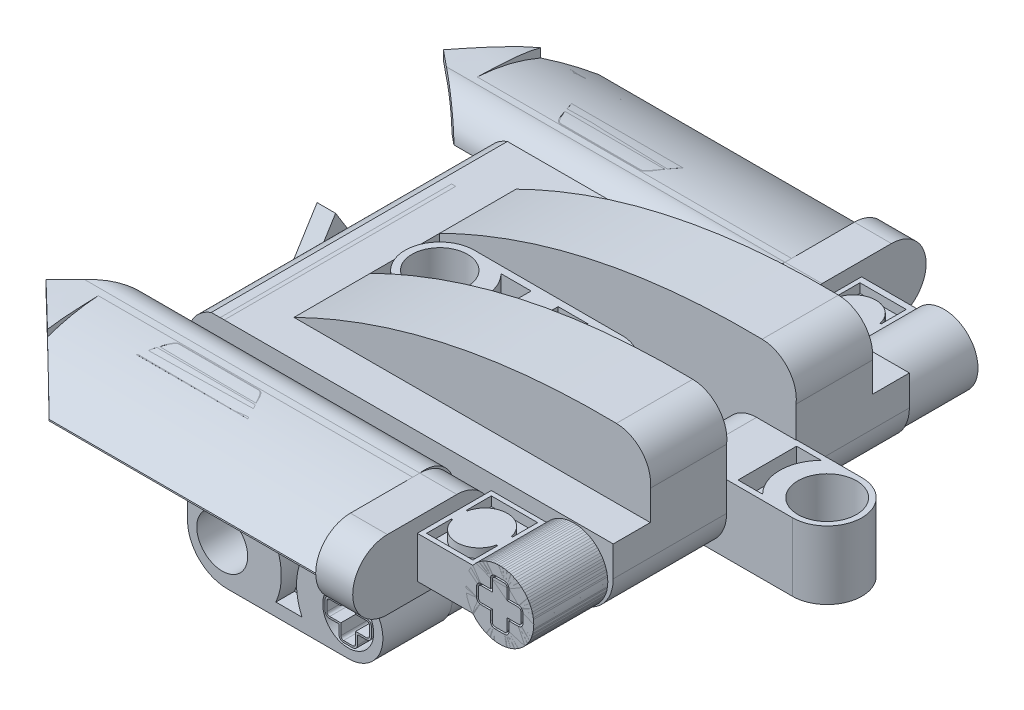
from build123d import *
from OCP.BRepAlgoAPI import BRepAlgoAPI_Cut
from OCP.TopTools import TopTools_ListOfShape

# Parameters (mm, degrees)
BOSS_EXTRUDE2_DEPTH      = 32
SKETCH2_W                = 44.115185982
SKETCH2_H                = 4
SKETCH2_W_2              = 43.1238244
CUT_EXTRUDE1_DEPTH       = 12
SKETCH3_W                = 38.535650362
SKETCH3_H                = 7.5
CUT_EXTRUDE2_DEPTH       = 11
SKETCH4_W                = 17
SKETCH4_H                = 21.78758901
CUT_EXTRUDE3_DEPTH       = 7.5
BOSS_EXTRUDE5_DEPTH      = 25
SKETCH9_W                = 17
SKETCH9_H                = 7.5
CUT_EXTRUDE5_DEPTH       = 55.618775146
BOSS_EXTRUDE6_DEPTH      = 4
BOSS_EXTRUDE7_DEPTH      = 4
SKETCH12_R               = 3.66973068
BOSS_EXTRUDE8_DEPTH      = 14
SKETCH13_R               = 4.472188962
BOSS_EXTRUDE9_DEPTH      = 7.5
SKETCH14_R               = 2.5
BOSS_EXTRUDE10_DEPTH     = 10
BOSS_EXTRUDE11_DEPTH     = 2
SKETCH16_R               = 3.000305408
BOSS_EXTRUDE12_DEPTH     = 3.5
CUT_EXTRUDE6_DEPTH       = 2
BOSS_EXTRUDE13_DEPTH     = 8
BOSS_EXTRUDE14_DEPTH     = 4
BOSS_EXTRUDE16_DEPTH     = 38.4
BOSS_EXTRUDE17_DEPTH     = 7.5
CUT_EXTRUDE13_DEPTH      = 34
CUT_EXTRUDE14_START      = 12.794424309
CUT_EXTRUDE14_DEPTH      = 16.041695252
SKETCH31_R               = 3.677039636
BOSS_EXTRUDE18_DEPTH     = 34
BOSS_EXTRUDE19_START     = -20.3
BOSS_EXTRUDE19_DEPTH     = 7.5
FILLET1_START            = -4.26381126
FILLET1_DEPTH            = 8.26381126
SKETCH34_R               = 3.166482097
CUT_EXTRUDE15_DEPTH      = 67.385597078
CUT_EXTRUDE16_DEPTH      = 2
CUT_EXTRUDE18_DEPTH      = 1
CUT_EXTRUDE19_DEPTH      = 1
CUT_EXTRUDE20_DEPTH      = 80.14808
SKETCH41_R               = 2.75
CUT_EXTRUDE23_DEPTH      = 74.811781159
BOSS_EXTRUDE20_DEPTH     = 32
SKETCH43_R               = 2.75
CUT_EXTRUDE24_DEPTH      = 12
SKETCH45_R               = 2.75
CUT_EXTRUDE25_DEPTH      = 12
CUT_EXTRUDE26_DEPTH      = 2
CUT_EXTRUDE27_DEPTH      = 2
CUT_EXTRUDE28_DEPTH      = 2
CUT_EXTRUDE29_DEPTH      = 2
CUT_EXTRUDE31_DEPTH      = 12
CUT_EXTRUDE41_DEPTH      = 12
CUT_EXTRUDE42_DEPTH      = 12
CUT_EXTRUDE43_DEPTH      = 12
CUT_EXTRUDE43_DEPTH_BACK = 12


with BuildPart() as part:
    # Sketch1 → Boss-Extrude2 (new body)
    with BuildSketch(Plane.XY):
        with BuildLine():
            Line((-1.702951694, 3.212286003), (3.23618874, 3.218855942))
            add(Edge.make_bspline(
                [(38.075385005, 10.724063237), (19.092860526, 11.058020979), (3.23618874, 3.218855942)],
                knots=[0, 0, 0, 0.804971989, 0.804971989, 0.804971989], degree=2))
            ThreePointArc((38.075385005, 10.724063237), (40.853292016, 9.414045085), (41.73618874, 6.472377481))
            Line((41.73618874, 6.472377481), (41.73618874, 0.00239581))
            ThreePointArc((41.73618874, 0.00239581), (40.487492588, -3.013421211), (37.472377481, -4.26381126))
            Line((37.472377481, -4.26381126), (3.23618874, -4.283042964))
            Line((3.23618874, -4.283042964), (3.23618874, -14.2851932))
            Line((3.23618874, -14.2851932), (13.097524642, -14.2851932))
            ThreePointArc((13.097524642, -14.2851932), (16.847524642, -18.0351932), (13.097524642, -21.7851932))
            Line((13.097524642, -21.7851932), (0, -21.7851932))
            ThreePointArc((0, -21.7851932), (-3.014969855, -20.536351796), (-4.26381126, -17.52138194))
            Line((-4.26381126, -17.52138194), (-4.26381126, 0.00239581))
            ThreePointArc((-4.26381126, 0.00239581), (-3.438448359, 1.970394564), (-1.702951694, 3.212286003))
        make_face()
    extrude(amount=-BOSS_EXTRUDE2_DEPTH)

    # Sketch2 → Cut-Extrude1 (cut)
    with BuildSketch(Plane(origin=(-0.00427592, 3.214545545, 0), x_dir=(0.9999991153136247, 0.0013301774197189266, 0), z_dir=(-0.0013301774197189266, 0.9999991153136247, 0))):
        with Locations((25.298060518, 2)):
            Rectangle(SKETCH2_W, SKETCH2_H)
        with Locations((24.802379727, 30)):
            Rectangle(SKETCH2_W_2, SKETCH2_H)
    extrude(amount=CUT_EXTRUDE1_DEPTH, mode=Mode.SUBTRACT)

    # Sketch3 → Cut-Extrude2 (cut, symmetric)
    with BuildSketch(Plane(origin=(-0.00427592, 3.214545545, 0), x_dir=(0.9999991153136247, 0.0013301774197189266, 0), z_dir=(-0.0013301774197189266, 0.9999991153136247, 0))):
        with Locations((22.508292708, 16)):
            Rectangle(SKETCH3_W, SKETCH3_H)
    extrude(amount=CUT_EXTRUDE2_DEPTH, both=True, mode=Mode.SUBTRACT)

    # Sketch4 → Cut-Extrude3 (cut)
    with BuildSketch(Plane.ZY.offset(4.26381126)):
        with Locations((-16, -10.891398695)):
            Rectangle(SKETCH4_W, SKETCH4_H)
    extrude(amount=-CUT_EXTRUDE3_DEPTH, mode=Mode.SUBTRACT)

    # Sketch7 → Boss-Extrude5 (add)
    with BuildSketch(Plane.XY):
        with BuildLine():
            ThreePointArc((3.241178169, -0.532090709), (-0.511316545, -4.283037359), (-4.26381126, -0.532090709))
            ThreePointArc((-4.26381126, -0.532090709), (-0.511316545, 3.220404006), (3.241178169, -0.532090709))
        make_face()
    extrude(amount=-BOSS_EXTRUDE5_DEPTH)

    # Sketch9 → Cut-Extrude5 (cut, through all)
    with BuildSketch(Plane.ZY.offset(-3.23618874)):
        with Locations((-16, -18.0351932)):
            Rectangle(SKETCH9_W, SKETCH9_H)
    extrude(amount=-CUT_EXTRUDE5_DEPTH, mode=Mode.SUBTRACT)


with BuildPart() as body_2:
    # Sketch10 → Boss-Extrude6 (new body)
    with BuildSketch(Plane.XY.offset(-24.5)):
        with BuildLine():
            Line((-0.301242903, -14.36546252), (13.097524642, -14.36546252))
            ThreePointArc((13.097524642, -14.36546252), (16.767255322, -18.0351932), (13.097524642, -21.70492388))
            Line((13.097524642, -21.70492388), (-0.301242903, -21.70492388))
            ThreePointArc((-0.301242903, -21.70492388), (-3.970973583, -18.0351932), (-0.301242903, -14.36546252))
        make_face()
    extrude(amount=BOSS_EXTRUDE6_DEPTH)


with BuildPart() as body_3:
    # Sketch11 → Boss-Extrude7 (new body)
    with BuildSketch(Plane(origin=(0, 0, -7.5), x_dir=(-1, 0, 0), z_dir=(0, 0, -1))):
        with BuildLine():
            Line((-13.098801019, -14.319293562), (0.299966526, -14.319293562))
            ThreePointArc((0.299966526, -14.319293562), (3.969697206, -17.989024242), (0.299966526, -21.658754922))
            Line((0.299966526, -21.658754922), (-13.098801019, -21.658754922))
            ThreePointArc((-13.098801019, -21.658754922), (-16.768531699, -17.989024242), (-13.098801019, -14.319293562))
        make_face()
    extrude(amount=BOSS_EXTRUDE7_DEPTH)


with BuildPart() as body_4:
    # Sketch12 → Boss-Extrude8 (new body)
    with BuildSketch(Plane(origin=(0, 0, -11.5), x_dir=(-1, 0, 0), z_dir=(0, 0, -1))):
        with Locations((0.299966526, -17.989024242)):
            Circle(SKETCH12_R)
    extrude(amount=BOSS_EXTRUDE8_DEPTH)


with BuildPart() as body_5:
    # Sketch13 → Boss-Extrude9 (new body)
    with BuildSketch(Plane(origin=(0, -21.819293562, 0), x_dir=(1, 0, 0), z_dir=(0, 1, 0))):
        with Locations(Location((-0.299966526, 15.996741348, 0), (0, 0, 180))):
            Circle(SKETCH13_R)
    extrude(amount=BOSS_EXTRUDE9_DEPTH)


with BuildPart() as body_6:
    # Sketch14 → Boss-Extrude10 (new body)
    with BuildSketch(Plane(origin=(0, -14.319293562, 0), x_dir=(1, 0, 0), z_dir=(0, 1, 0))):
        with Locations(Location((-0.299966526, 15.996741348, 0), (0, 0, 180))):
            Circle(SKETCH14_R)
    extrude(amount=BOSS_EXTRUDE10_DEPTH)


with BuildPart() as body_7:
    # Sketch15 → Boss-Extrude11 (new body)
    with BuildSketch(Plane.ZY.offset(4.26381126)):
        Polygon((-16, 3.212286003), (-25.960182344, -12.787713997), (-6.039817656, -12.787713997), align=None)
    extrude(amount=BOSS_EXTRUDE11_DEPTH)


with BuildPart() as body_8:
    # Sketch16 → Boss-Extrude12 (new, symmetric)
    with BuildSketch(Plane(origin=(0, 0, 0), x_dir=(1, 0, 0), z_dir=(0, 1, 0))):
        with BuildLine():
            Line((6.98618874, 19.75), (22.98618874, 19.75))
            ThreePointArc((22.98618874, 19.75), (26.73618874, 16), (22.98618874, 12.25))
            Line((22.98618874, 12.25), (6.98618874, 12.25))
            ThreePointArc((6.98618874, 12.25), (3.23618874, 16), (6.98618874, 19.75))
        make_face()
        with Locations(Location((6.98618874, 16, 0), (0, 0, 270))):
            Circle(SKETCH16_R, mode=Mode.SUBTRACT)
        with Locations(Location((22.98618874, 16, 0), (0, 0, 270))):
            Circle(SKETCH16_R, mode=Mode.SUBTRACT)
    extrude(amount=BOSS_EXTRUDE12_DEPTH, both=True)

    # Sketch17 → Cut-Extrude6 (cut)
    with BuildSketch(Plane(origin=(0, 3.5, 0), x_dir=(1, 0, 0), z_dir=(0, 1, 0))):
        with BuildLine():
            Line((10.605788643, 19.000305408), (13.858381621, 19.000305408))
            Line((13.858381621, 19.000305408), (13.858381621, 12.999694592))
            Line((13.858381621, 12.999694592), (10.605788643, 12.999694592))
            ThreePointArc((10.605788643, 12.999694592), (11.848555834, 16), (10.605788643, 19.000305408))
        make_face()
        with BuildLine():
            Line((20.033757679, 12.999694592), (16.781164701, 12.999694592))
            Line((16.781164701, 12.999694592), (16.781164701, 19.000305408))
            Line((16.781164701, 19.000305408), (20.033757679, 19.000305408))
            ThreePointArc((20.033757679, 19.000305408), (18.790990488, 16), (20.033757679, 12.999694592))
        make_face()
    extrude(amount=-CUT_EXTRUDE6_DEPTH, mode=Mode.SUBTRACT)


with BuildPart() as body_9:
    # Sketch18 → Boss-Extrude13 (new body)
    with BuildSketch(Plane.XY):
        with BuildLine():
            Line((34.56409268, 1.680710245), (28.56409268, 1.680710245))
            Line((28.56409268, 1.680710245), (28.56409268, -2.819289755))
            Line((28.56409268, -2.819289755), (34.56409268, -2.819289755))
            ThreePointArc((34.56409268, -2.819289755), (41.149417117, -0.569289755), (34.56409268, 1.680710245))
        make_face()
    extrude(amount=BOSS_EXTRUDE13_DEPTH)


with BuildPart() as body_10:
    # Sketch19 → Boss-Extrude14 (new body)
    with BuildSketch(Plane.ZY.offset(-28.56409268)):
        with BuildLine():
            Line((11.229953049, -4.320127931), (3.729953049, -4.320127931))
            ThreePointArc((3.729953049, -4.320127931), (-0.020046951, -0.570127931), (3.729953049, 3.179872069))
            Line((3.729953049, 3.179872069), (11.229953049, 3.179872069))
            ThreePointArc((11.229953049, 3.179872069), (14.979953049, -0.570127931), (11.229953049, -4.320127931))
        make_face()
    extrude(amount=BOSS_EXTRUDE14_DEPTH)


with BuildPart() as body_11:
    # Sketch24 → Boss-Extrude16 (new body)
    with BuildSketch(Plane.ZY.offset(-24.56409268)):
        with BuildLine():
            Line((0, 0), (1, 0))
            ThreePointArc((1, 0), (1.799126894, 1.705934773), (3.621301326, 2.183948983))
            add(Edge.make_bspline(
                [(14.055609261, -0.965878552), (14.00316326, -0.787572066), (13.863542609, -0.427121258), (13.512494301, 0.144306384), (12.906219021, 0.730186055), (11.862686925, 1.274546234), (10.075490307, 1.789901434), (7.283127213, 2.067368154), (4.822788537, 2.126020481), (3.621301326, 2.183948983)],
                knots=[-0.004258653, -0.004258653, -0.004258653, -0.004258653, 0.058507512, 0.121273678, 0.24680601, 0.372338342, 0.497870673, 0.748935337, 1, 1, 1, 1], degree=3))
            Line((14.055609261, -0.965878552), (15.014970514, -0.683697782))
            add(Edge.make_bspline(
                [(3.729953049, 3.179872069), (8.464913465, 2.951580699), (13.880932145, 3.171818212), (15.014970514, -0.683697782)],
                knots=[0, 0, 0, 0, 1, 1, 1, 1], degree=3))
            ThreePointArc((3.729953049, 3.179872069), (1.131137136, 2.450721125), (0, 0))
        make_face()
    extrude(amount=BOSS_EXTRUDE16_DEPTH)


with BuildPart() as body_12:
    # Sketch27 → Boss-Extrude17 (new body)
    with BuildSketch(Plane.XY):
        with BuildLine():
            Line((-0.563437375, 3.136846364), (8.061078764, 3.136846364))
            ThreePointArc((8.061078764, 3.136846364), (11.769668271, -0.571743143), (8.061078764, -4.280332649))
            Line((8.061078764, -4.280332649), (-0.563437375, -4.280332649))
            ThreePointArc((-0.563437375, -4.280332649), (-4.272026881, -0.571743143), (-0.563437375, 3.136846364))
        make_face()
    extrude(amount=BOSS_EXTRUDE17_DEPTH)


with BuildPart() as cut_extrude13_tool:
    # Sketch29 → Cut-Extrude13 (new body)
    with BuildSketch(Plane.ZY.offset(-24.56409268)):
        with BuildLine():
            Line((3.729953049, 3.179872069), (11.229953049, 3.179872069))
            ThreePointArc((11.229953049, 3.179872069), (13.881603478, 2.081522498), (14.979953049, -0.570127931))
            ThreePointArc((14.979953049, -0.570127931), (9.634679324, 2.144050894), (3.729953049, 3.179872069))
        make_face()
    extrude(amount=CUT_EXTRUDE13_DEPTH)


with BuildPart() as body_11_1:
    add(body_11.part)

    # Cut-Extrude13: cut by cut_extrude13_tool
    add(cut_extrude13_tool.part, mode=Mode.SUBTRACT)


with BuildPart() as body_12_1:
    add(body_12.part)

    # Cut-Extrude13: cut by cut_extrude13_tool
    add(cut_extrude13_tool.part, mode=Mode.SUBTRACT)

    # Cut-Extrude14: read off the stored shape, not the designer's step
    # Cut-Extrude14 outline → Cut-Extrude14 (cut)
    with BuildSketch(Plane.ZY.offset(-24.56409268).offset(CUT_EXTRUDE14_START)):
        with BuildLine():
            Line((0, 3.136846364), (0, 0))
            ThreePointArc((0, 0), (0.888029379, 2.053731462), (2.845888469, 3.136873594))
            Line((2.845888469, 3.136873594), (0, 3.136846364))
        make_face()
    extrude(amount=CUT_EXTRUDE14_DEPTH, mode=Mode.SUBTRACT)


with BuildPart() as body_13:
    # Sketch31 → Boss-Extrude18 (new body)
    with BuildSketch(Plane.XY.offset(8)):
        with Locations((37.472377481, -0.569289755)):
            Circle(SKETCH31_R)
    extrude(amount=-BOSS_EXTRUDE18_DEPTH)


with BuildPart() as body_14:
    # Sketch33 → Boss-Extrude19 (new body)
    with BuildSketch(Plane.XY.offset(8).offset(BOSS_EXTRUDE19_START)):
        Polygon((37.472377481, 3.107749881), (52.551789104, 3.107749881), (52.551789104, -4.246329391), (37.472377481, -4.26381126), align=None)
    extrude(amount=-BOSS_EXTRUDE19_DEPTH)


with BuildPart() as fillet1_tool:
    # Fillet1: read off the stored shape, not the designer's step
    # Fillet1 outline → Fillet1 (new body)
    with BuildSketch(Plane(origin=(0, 0, 0), x_dir=(1, 0, 0), z_dir=(0, 1, 0)).offset(FILLET1_START)):
        with BuildLine():
            ThreePointArc((48.80178149, 19.800002538), (51.453433714, 18.701652224), (52.551784028, 16.05))
            Line((52.551784028, 16.05), (52.551789104, 19.8))
            Line((52.551789104, 19.8), (48.80178149, 19.800002538))
        make_face()
        with BuildLine():
            ThreePointArc((52.551784028, 16.05), (51.453433714, 13.398347776), (48.80178149, 12.299997462))
            Line((48.80178149, 12.299997462), (52.551789104, 12.3))
            Line((52.551789104, 12.3), (52.551784028, 16.05))
        make_face()
    extrude(amount=FILLET1_DEPTH)


with BuildPart() as body_14_1:
    add(body_14.part)

    # Fillet1: cut by fillet1_tool, with a tolerance
    fillet1_stock = TopTools_ListOfShape()
    fillet1_stock.Append(body_14_1.part.wrapped)
    fillet1_tools = TopTools_ListOfShape()
    fillet1_tools.Append(fillet1_tool.part.wrapped)
    fillet1_cut = BRepAlgoAPI_Cut()
    fillet1_cut.SetArguments(fillet1_stock)
    fillet1_cut.SetTools(fillet1_tools)
    fillet1_cut.SetFuzzyValue(0.00001)
    fillet1_cut.Build()
    add(Compound.cast(fillet1_cut.Shape()).solids(), mode=Mode.REPLACE)

    # Sketch34 → Cut-Extrude15 (cut, through all)
    with BuildSketch(Plane(origin=(0, 3.107749881, 0), x_dir=(1, 0, 0), z_dir=(0, 1, 0))):
        with Locations(Location((48.80178149, 16.05, 0), (0, 0, 270))):
            Circle(SKETCH34_R)
    extrude(amount=-CUT_EXTRUDE15_DEPTH, mode=Mode.SUBTRACT)

    # Sketch35 → Cut-Extrude16 (cut)
    with BuildSketch(Plane(origin=(0, 3.107749881, 0), x_dir=(1, 0, 0), z_dir=(0, 1, 0))):
        with BuildLine():
            Line((44.995529866, 19.216482097), (42.332858945, 19.216482097))
            Line((42.332858945, 19.216482097), (42.332858945, 12.883517903))
            Line((42.332858945, 12.883517903), (44.995529866, 12.883517903))
            ThreePointArc((44.995529866, 12.883517903), (43.683930037, 16.05), (44.995529866, 19.216482097))
        make_face()
    extrude(amount=-CUT_EXTRUDE16_DEPTH, mode=Mode.SUBTRACT)


with BuildPart() as body_15:
    # Mirror1: mirrored copy
    add(body_11_1.part.mirror(Plane.XY.offset(-16)))

    # Sketch53 → Cut-Extrude42 (cut)
    with BuildSketch(Plane(origin=(0, 0, 0), x_dir=(1, 0, 0), z_dir=(0, 1, 0))):
        Polygon((-13.83590732, 37.22), (-7.481864303, 32), (-13.83590732, 32), align=None)
    extrude(amount=CUT_EXTRUDE42_DEPTH, mode=Mode.SUBTRACT)

    # Sketch54 → Cut-Extrude43 (cut, two sides: drawn at the far end of the back side and taken through both)
    with BuildSketch(Plane(origin=(0, 0, 0), x_dir=(1, 0, 0), z_dir=(0, 1, 0)).offset(-CUT_EXTRUDE43_DEPTH_BACK)):
        Polygon((-13.83590732, 37.22), (-6.119990132, 47.927418423), (-13.840886664, 47.927418423), align=None)
    extrude(amount=CUT_EXTRUDE43_DEPTH + CUT_EXTRUDE43_DEPTH_BACK, mode=Mode.SUBTRACT)


with BuildPart() as body_16:
    # Mirror1 2: mirrored copy
    add(body_9.part.mirror(Plane.XY.offset(-16)))

    # Sketch38 → Cut-Extrude19 (cut)
    with BuildSketch(Plane(origin=(0, 1.680710245, 0), x_dir=(1, 0, 0), z_dir=(0, 1, 0))):
        with BuildLine():
            Line((29.033448476, 39.360022667), (29.033448476, 36.663656148))
            Line((29.033448476, 36.663656148), (29.156601429, 36.663656148))
            ThreePointArc((29.156601429, 36.663656148), (31.533448476, 38.592524584), (33.910295522, 36.663656148))
            Line((33.910295522, 36.663656148), (34.033448476, 36.663656148))
            Line((34.033448476, 36.663656148), (34.033448476, 39.360022667))
            Line((34.033448476, 39.360022667), (29.033448476, 39.360022667))
        make_face()
        with BuildLine():
            Line((34.033448476, 32.360022667), (29.033448476, 32.360022667))
            Line((29.033448476, 32.360022667), (29.033448476, 35.056389187))
            Line((29.033448476, 35.056389187), (29.156601429, 35.056389187))
            ThreePointArc((29.156601429, 35.056389187), (31.533448476, 33.12752075), (33.910295522, 35.056389187))
            Line((33.910295522, 35.056389187), (34.033448476, 35.056389187))
            Line((34.033448476, 35.056389187), (34.033448476, 32.360022667))
        make_face()
    extrude(amount=-CUT_EXTRUDE19_DEPTH, mode=Mode.SUBTRACT)


with BuildPart() as body_17:
    # Mirror1 3: mirrored copy
    add(body_10.part.mirror(Plane.XY.offset(-16)))


with BuildPart() as body_18:
    # Mirror1 4: mirrored copy
    add(body_12_1.part.mirror(Plane.XY.offset(-16)))


with BuildPart() as cut_extrude18_tool:
    # Sketch37 → Cut-Extrude18 (new body)
    with BuildSketch(Plane(origin=(0, 1.680710245, 0), x_dir=(1, 0, 0), z_dir=(0, 1, 0))):
        with BuildLine():
            Line((29.06409268, -0.5), (29.06409268, -3.196366519))
            Line((29.06409268, -3.196366519), (29.187245634, -3.196366519))
            ThreePointArc((29.187245634, -3.196366519), (31.56409268, -1.267498083), (33.940939726, -3.196366519))
            Line((33.940939726, -3.196366519), (34.06409268, -3.196366519))
            Line((34.06409268, -3.196366519), (34.06409268, -0.5))
            Line((34.06409268, -0.5), (29.06409268, -0.5))
        make_face()
        with BuildLine():
            Line((34.06409268, -7.5), (29.06409268, -7.5))
            Line((29.06409268, -7.5), (29.06409268, -4.803633481))
            Line((29.06409268, -4.803633481), (29.187245634, -4.803633481))
            ThreePointArc((29.187245634, -4.803633481), (31.56409268, -6.732501917), (33.940939726, -4.803633481))
            Line((33.940939726, -4.803633481), (34.06409268, -4.803633481))
            Line((34.06409268, -4.803633481), (34.06409268, -7.5))
        make_face()
    extrude(amount=-CUT_EXTRUDE18_DEPTH)


with BuildPart() as body_9_1:
    add(body_9.part)

    # Cut-Extrude18: cut by cut_extrude18_tool
    add(cut_extrude18_tool.part, mode=Mode.SUBTRACT)


with BuildPart() as body_13_1:
    add(body_13.part)

    # Cut-Extrude18: cut by cut_extrude18_tool
    add(cut_extrude18_tool.part, mode=Mode.SUBTRACT)


with BuildPart() as cut_extrude20_tool:
    # Sketch39 → Cut-Extrude20 (new, through all)
    with BuildSketch(Plane.XY.offset(8)):
        with BuildLine():
            Line((36.472377481, -1.569289755), (36.472377481, -2.569289755))
            ThreePointArc((36.472377481, -2.569289755), (36.61882409, -2.922843145), (36.972377481, -3.069289755))
            Line((36.972377481, -3.069289755), (37.972377481, -3.069289755))
            ThreePointArc((37.972377481, -3.069289755), (38.325930871, -2.922843145), (38.472377481, -2.569289755))
            Line((38.472377481, -2.569289755), (38.472377481, -1.569289755))
            Line((38.472377481, -1.569289755), (39.472377481, -1.569289755))
            ThreePointArc((39.472377481, -1.569289755), (39.825930871, -1.422843145), (39.972377481, -1.069289755))
            Line((39.972377481, -1.069289755), (39.972377481, -0.069289755))
            ThreePointArc((39.972377481, -0.069289755), (39.825930871, 0.284263636), (39.472377481, 0.430710245))
            Line((39.472377481, 0.430710245), (38.472377481, 0.430710245))
            Line((38.472377481, 0.430710245), (38.472377481, 1.430710245))
            ThreePointArc((38.472377481, 1.430710245), (38.325930871, 1.784263636), (37.972377481, 1.930710245))
            Line((37.972377481, 1.930710245), (36.972377481, 1.930710245))
            ThreePointArc((36.972377481, 1.930710245), (36.61882409, 1.784263636), (36.472377481, 1.430710245))
            Line((36.472377481, 1.430710245), (36.472377481, 0.430710245))
            Line((36.472377481, 0.430710245), (35.472377481, 0.430710245))
            ThreePointArc((35.472377481, 0.430710245), (35.11882409, 0.284263636), (34.972377481, -0.069289755))
            Line((34.972377481, -0.069289755), (34.972377481, -1.069289755))
            ThreePointArc((34.972377481, -1.069289755), (35.11882409, -1.422843145), (35.472377481, -1.569289755))
            Line((35.472377481, -1.569289755), (36.472377481, -1.569289755))
        make_face()
        with BuildLine():
            Line((38.272377481, 1.430710245), (38.272377481, 0.230710245))
            Line((38.272377481, 0.230710245), (39.472377481, 0.230710245))
            ThreePointArc((39.472377481, 0.230710245), (39.684509515, 0.142842279), (39.772377481, -0.069289755))
            Line((39.772377481, -0.069289755), (39.772377481, -1.069289755))
            ThreePointArc((39.772377481, -1.069289755), (39.684509515, -1.281421789), (39.472377481, -1.369289755))
            Line((39.472377481, -1.369289755), (38.272377481, -1.369289755))
            Line((38.272377481, -1.369289755), (38.272377481, -2.569289755))
            ThreePointArc((38.272377481, -2.569289755), (38.184509515, -2.781421789), (37.972377481, -2.869289755))
            Line((37.972377481, -2.869289755), (36.972377481, -2.869289755))
            ThreePointArc((36.972377481, -2.869289755), (36.760245447, -2.781421789), (36.672377481, -2.569289755))
            Line((36.672377481, -2.569289755), (36.672377481, -1.369289755))
            Line((36.672377481, -1.369289755), (35.472377481, -1.369289755))
            ThreePointArc((35.472377481, -1.369289755), (35.260245447, -1.281421789), (35.172377481, -1.069289755))
            Line((35.172377481, -1.069289755), (35.172377481, -0.069289755))
            ThreePointArc((35.172377481, -0.069289755), (35.260245447, 0.142842279), (35.472377481, 0.230710245))
            Line((35.472377481, 0.230710245), (36.672377481, 0.230710245))
            Line((36.672377481, 0.230710245), (36.672377481, 1.430710245))
            ThreePointArc((36.672377481, 1.430710245), (36.760245447, 1.642842279), (36.972377481, 1.730710245))
            Line((36.972377481, 1.730710245), (37.972377481, 1.730710245))
            ThreePointArc((37.972377481, 1.730710245), (38.184509515, 1.642842279), (38.272377481, 1.430710245))
        make_face(mode=Mode.SUBTRACT)
    extrude(amount=-CUT_EXTRUDE20_DEPTH)


with BuildPart() as part_1:
    add(part.part)

    # Cut-Extrude20: cut by cut_extrude20_tool
    add(cut_extrude20_tool.part, mode=Mode.SUBTRACT)


with BuildPart() as body_9_2:
    add(body_9_1.part)

    # Cut-Extrude20: cut by cut_extrude20_tool
    add(cut_extrude20_tool.part, mode=Mode.SUBTRACT)


with BuildPart() as body_13_2:
    add(body_13_1.part)

    # Cut-Extrude20: cut by cut_extrude20_tool
    add(cut_extrude20_tool.part, mode=Mode.SUBTRACT)


with BuildPart() as body_14_2:
    add(body_14_1.part)

    # Cut-Extrude20: cut by cut_extrude20_tool
    add(cut_extrude20_tool.part, mode=Mode.SUBTRACT)


with BuildPart() as body_16_1:
    add(body_16.part)

    # Cut-Extrude20: cut by cut_extrude20_tool
    add(cut_extrude20_tool.part, mode=Mode.SUBTRACT)


with BuildPart() as cut_extrude20_piece_1:
    # of the separate pieces the step leaves, piece 1, a body of its own (cut_extrude20_pieces)
    add(part_1.part.solids().sort_by_distance((13.097524642, -21.7851932, 0))[0])


with BuildPart() as cut_extrude20_piece_2:
    # of the separate pieces the step leaves, piece 2, a body of its own (cut_extrude20_pieces)
    add(part_1.part.solids().sort_by_distance((37.972377481, 1.730710245, -32))[0])


with BuildPart() as cut_extrude20_piece_3:
    # of the separate pieces the step leaves, piece 3, a body of its own (cut_extrude20_pieces)
    add(part_1.part.solids().sort_by_distance((37.972377481, 1.730710245, 0))[0])


with BuildPart() as cut_extrude20_piece_1_of_body_9:
    # of the separate pieces the step leaves, piece 1, a body of its own (cut_extrude20_pieces_of_body_9)
    add(body_9_2.part.solids().sort_by_distance((34.56409268, 1.680710245, 0))[0])


with BuildPart() as cut_extrude20_piece_2_of_body_9:
    # of the separate pieces the step leaves, piece 2, a body of its own (cut_extrude20_pieces_of_body_9)
    add(body_9_2.part.solids().sort_by_distance((36.972377481, 1.730710245, 0))[0])


with BuildPart() as cut_extrude20_piece_1_of_body_13:
    # of the separate pieces the step leaves, piece 1, a body of its own (cut_extrude20_pieces_of_body_13)
    add(body_13_2.part.solids().sort_by_distance((41.149417117, -0.569289755, 8))[0])


with BuildPart() as cut_extrude20_piece_2_of_body_13:
    # of the separate pieces the step leaves, piece 2, a body of its own (cut_extrude20_pieces_of_body_13)
    add(body_13_2.part.solids().sort_by_distance((36.972377481, 1.730710245, 8))[0])


with BuildPart() as cut_extrude20_piece_1_of_body_14:
    # of the separate pieces the step leaves, piece 1, a body of its own (cut_extrude20_pieces_of_body_14)
    add(body_14_2.part.solids().sort_by_distance((37.472377481, 3.107749881, -12.3))[0])


with BuildPart() as cut_extrude20_piece_2_of_body_14:
    # of the separate pieces the step leaves, piece 2, a body of its own (cut_extrude20_pieces_of_body_14)
    add(body_14_2.part.solids().sort_by_distance((37.472377481, -2.869289755, -12.3))[0])


with BuildPart() as cut_extrude20_piece_1_of_body_16:
    # of the separate pieces the step leaves, piece 1, a body of its own (cut_extrude20_pieces_of_body_16)
    add(body_16_1.part.solids().sort_by_distance((34.56409268, 1.680710245, -32))[0])


with BuildPart() as cut_extrude20_piece_2_of_body_16:
    # of the separate pieces the step leaves, piece 2, a body of its own (cut_extrude20_pieces_of_body_16)
    add(body_16_1.part.solids().sort_by_distance((36.972377481, 1.730710245, -32))[0])


with BuildPart() as cut_extrude23_tool:
    # Sketch41 → Cut-Extrude23 (new, through all)
    with BuildSketch(Plane.XY):
        with Locations((13.097524642, -18.0351932)):
            Circle(SKETCH41_R)
    extrude(amount=-CUT_EXTRUDE23_DEPTH)


with BuildPart() as body_2_1:
    add(body_2.part)

    # Cut-Extrude23: cut by cut_extrude23_tool
    add(cut_extrude23_tool.part, mode=Mode.SUBTRACT)


with BuildPart() as body_3_1:
    add(body_3.part)

    # Cut-Extrude23: cut by cut_extrude23_tool
    add(cut_extrude23_tool.part, mode=Mode.SUBTRACT)


with BuildPart() as cut_extrude20_piece_1_1:
    add(cut_extrude20_piece_1.part)

    # Cut-Extrude23: cut by cut_extrude23_tool
    add(cut_extrude23_tool.part, mode=Mode.SUBTRACT)


with BuildPart() as body_25:
    # Sketch42 → Boss-Extrude20 (new body)
    with BuildSketch(Plane.XY):
        with BuildLine():
            Line((12.097524642, -19.0351932), (12.097524642, -20.0351932))
            ThreePointArc((12.097524642, -20.0351932), (12.243971251, -20.38874659), (12.597524642, -20.5351932))
            Line((12.597524642, -20.5351932), (13.597524642, -20.5351932))
            ThreePointArc((13.597524642, -20.5351932), (13.951078033, -20.38874659), (14.097524642, -20.0351932))
            Line((14.097524642, -20.0351932), (14.097524642, -19.0351932))
            Line((14.097524642, -19.0351932), (15.097524642, -19.0351932))
            ThreePointArc((15.097524642, -19.0351932), (15.451078033, -18.88874659), (15.597524642, -18.5351932))
            Line((15.597524642, -18.5351932), (15.597524642, -17.5351932))
            ThreePointArc((15.597524642, -17.5351932), (15.451078033, -17.181639809), (15.097524642, -17.0351932))
            Line((15.097524642, -17.0351932), (14.097524642, -17.0351932))
            Line((14.097524642, -17.0351932), (14.097524642, -16.0351932))
            ThreePointArc((14.097524642, -16.0351932), (13.951078033, -15.681639809), (13.597524642, -15.5351932))
            Line((13.597524642, -15.5351932), (12.597524642, -15.5351932))
            ThreePointArc((12.597524642, -15.5351932), (12.243971251, -15.681639809), (12.097524642, -16.0351932))
            Line((12.097524642, -16.0351932), (12.097524642, -17.0351932))
            Line((12.097524642, -17.0351932), (11.097524642, -17.0351932))
            ThreePointArc((11.097524642, -17.0351932), (10.743971251, -17.181639809), (10.597524642, -17.5351932))
            Line((10.597524642, -17.5351932), (10.597524642, -18.5351932))
            ThreePointArc((10.597524642, -18.5351932), (10.743971251, -18.88874659), (11.097524642, -19.0351932))
            Line((11.097524642, -19.0351932), (12.097524642, -19.0351932))
        make_face()
        with BuildLine():
            Line((13.897524642, -16.0351932), (13.897524642, -17.2351932))
            Line((13.897524642, -17.2351932), (15.097524642, -17.2351932))
            ThreePointArc((15.097524642, -17.2351932), (15.309656676, -17.323061165), (15.397524642, -17.5351932))
            Line((15.397524642, -17.5351932), (15.397524642, -18.5351932))
            ThreePointArc((15.397524642, -18.5351932), (15.309656676, -18.747325234), (15.097524642, -18.8351932))
            Line((15.097524642, -18.8351932), (13.897524642, -18.8351932))
            Line((13.897524642, -18.8351932), (13.897524642, -20.0351932))
            ThreePointArc((13.897524642, -20.0351932), (13.809656676, -20.247325234), (13.597524642, -20.3351932))
            Line((13.597524642, -20.3351932), (12.597524642, -20.3351932))
            ThreePointArc((12.597524642, -20.3351932), (12.385392608, -20.247325234), (12.297524642, -20.0351932))
            Line((12.297524642, -20.0351932), (12.297524642, -18.8351932))
            Line((12.297524642, -18.8351932), (11.097524642, -18.8351932))
            ThreePointArc((11.097524642, -18.8351932), (10.885392608, -18.747325234), (10.797524642, -18.5351932))
            Line((10.797524642, -18.5351932), (10.797524642, -17.5351932))
            ThreePointArc((10.797524642, -17.5351932), (10.885392608, -17.323061165), (11.097524642, -17.2351932))
            Line((11.097524642, -17.2351932), (12.297524642, -17.2351932))
            Line((12.297524642, -17.2351932), (12.297524642, -16.0351932))
            ThreePointArc((12.297524642, -16.0351932), (12.385392608, -15.823061165), (12.597524642, -15.7351932))
            Line((12.597524642, -15.7351932), (13.597524642, -15.7351932))
            ThreePointArc((13.597524642, -15.7351932), (13.809656676, -15.823061165), (13.897524642, -16.0351932))
        make_face(mode=Mode.SUBTRACT)
    extrude(amount=-BOSS_EXTRUDE20_DEPTH)


with BuildPart() as cut_extrude24_tool:
    # Sketch43 → Cut-Extrude24 (new body)
    with BuildSketch(Plane.XY):
        with Locations((-0.51381126, -17.646552784)):
            Circle(SKETCH43_R)
        with Locations((-0.51381126, -8.767293779)):
            Circle(SKETCH43_R)
    extrude(amount=-CUT_EXTRUDE24_DEPTH)


with BuildPart() as body_3_2:
    add(body_3_1.part)

    # Cut-Extrude24: cut by cut_extrude24_tool
    add(cut_extrude24_tool.part, mode=Mode.SUBTRACT)


with BuildPart() as body_4_1:
    add(body_4.part)

    # Cut-Extrude24: cut by cut_extrude24_tool
    add(cut_extrude24_tool.part, mode=Mode.SUBTRACT)


with BuildPart() as body_5_1:
    add(body_5.part)

    # Cut-Extrude24: cut by cut_extrude24_tool
    add(cut_extrude24_tool.part, mode=Mode.SUBTRACT)


with BuildPart() as cut_extrude20_piece_1_2:
    add(cut_extrude20_piece_1_1.part)

    # Cut-Extrude24: cut by cut_extrude24_tool
    add(cut_extrude24_tool.part, mode=Mode.SUBTRACT)


with BuildPart() as cut_extrude25_tool:
    # Sketch45 → Cut-Extrude25 (new body)
    with BuildSketch(Plane(origin=(0, 0, -32), x_dir=(-1, 0, 0), z_dir=(0, 0, -1))):
        with Locations((0.51381126, -17.288848687)):
            Circle(SKETCH45_R)
        with Locations((0.51381126, -8.581446308)):
            Circle(SKETCH45_R)
    extrude(amount=-CUT_EXTRUDE25_DEPTH)


with BuildPart() as body_2_2:
    add(body_2_1.part)

    # Cut-Extrude25: cut by cut_extrude25_tool
    add(cut_extrude25_tool.part, mode=Mode.SUBTRACT)


with BuildPart() as body_4_2:
    add(body_4_1.part)

    # Cut-Extrude25: cut by cut_extrude25_tool
    add(cut_extrude25_tool.part, mode=Mode.SUBTRACT)


with BuildPart() as body_5_2:
    add(body_5_1.part)

    # Cut-Extrude25: cut by cut_extrude25_tool
    add(cut_extrude25_tool.part, mode=Mode.SUBTRACT)


with BuildPart() as cut_extrude20_piece_1_3:
    add(cut_extrude20_piece_1_2.part)

    # Cut-Extrude25: cut by cut_extrude25_tool
    add(cut_extrude25_tool.part, mode=Mode.SUBTRACT)

    # Sketch46 → Cut-Extrude26 (cut)
    with BuildSketch(Plane(origin=(0, 0, -32), x_dir=(-1, 0, 0), z_dir=(0, 0, -1))):
        with BuildLine():
            Line((2.933144891, -11.680200666), (2.933144891, -14.280200666))
            ThreePointArc((2.933144891, -14.280200666), (0.433144891, -13.402699665), (-2.066855109, -14.280200666))
            Line((-2.066855109, -14.280200666), (-2.066855109, -11.680200666))
            ThreePointArc((-2.066855109, -11.680200666), (0.433144891, -12.557701667), (2.933144891, -11.680200666))
        make_face()
    extrude(amount=-CUT_EXTRUDE26_DEPTH, mode=Mode.SUBTRACT)

    # Sketch47 → Cut-Extrude27 (cut)
    with BuildSketch(Plane(origin=(0, 0, -32), x_dir=(-1, 0, 0), z_dir=(0, 0, -1))):
        with BuildLine():
            Line((-5.141459339, -15.2851932), (-7.711298113, -15.2851932))
            ThreePointArc((-7.711298113, -15.2851932), (-7.125249415, -18.0351932), (-7.711298113, -20.7851932))
            Line((-7.711298113, -20.7851932), (-5.141459339, -20.7851932))
            ThreePointArc((-5.141459339, -20.7851932), (-5.727508037, -18.0351932), (-5.141459339, -15.2851932))
        make_face()
    extrude(amount=-CUT_EXTRUDE27_DEPTH, mode=Mode.SUBTRACT)

    # Sketch48 → Cut-Extrude28 (cut)
    with BuildSketch(Plane.XY):
        with BuildLine():
            Line((8.10057649, -14.896552784), (5.285876297, -14.896552784))
            ThreePointArc((5.285876297, -14.896552784), (5.871924995, -17.646552784), (5.285876297, -20.396552784))
            Line((5.285876297, -20.396552784), (8.10057649, -20.396552784))
            ThreePointArc((8.10057649, -20.396552784), (7.514527792, -17.646552784), (8.10057649, -14.896552784))
        make_face()
    extrude(amount=-CUT_EXTRUDE28_DEPTH, mode=Mode.SUBTRACT)

    # Sketch49 → Cut-Extrude29 (cut)
    with BuildSketch(Plane.XY):
        with BuildLine():
            Line((1.951404261, -11.819124588), (1.951404261, -14.584486086))
            ThreePointArc((1.951404261, -14.584486086), (-0.483497867, -13.758009621), (-2.918399995, -14.584486086))
            Line((-2.918399995, -14.584486086), (-2.918399995, -11.819124588))
            ThreePointArc((-2.918399995, -11.819124588), (-0.483497867, -12.645601053), (1.951404261, -11.819124588))
        make_face()
    extrude(amount=-CUT_EXTRUDE29_DEPTH, mode=Mode.SUBTRACT)


with BuildPart() as body_11_2:
    add(body_11_1.part)

    # Sketch25 → Cut-Extrude31 (cut)
    with BuildSketch(Plane(origin=(0, 0, 0), x_dir=(1, 0, 0), z_dir=(0, 1, 0))):
        Polygon((-13.83590732, 0), (-13.83590732, -5.720777152), (-7.481864303, 0), align=None)
    extrude(amount=CUT_EXTRUDE31_DEPTH, mode=Mode.SUBTRACT)

    # Sketch51 → Cut-Extrude41 (cut)
    with BuildSketch(Plane(origin=(0, 3.179872069, 0), x_dir=(1, 0, 0), z_dir=(0, 1, 0))):
        Polygon((-13.83590732, -5.720777152), (-3.277458253, -15.898849499), (-13.83590732, -15.898849499), align=None)
    extrude(amount=-CUT_EXTRUDE41_DEPTH, mode=Mode.SUBTRACT)


solid = Compound([body_6.part, body_7.part, body_8.part, body_10.part, body_12_1.part, body_15.part, body_17.part, body_18.part, cut_extrude20_piece_2.part, cut_extrude20_piece_3.part, cut_extrude20_piece_1_of_body_9.part, cut_extrude20_piece_2_of_body_9.part, cut_extrude20_piece_1_of_body_13.part, cut_extrude20_piece_2_of_body_13.part, cut_extrude20_piece_1_of_body_14.part, cut_extrude20_piece_2_of_body_14.part, cut_extrude20_piece_1_of_body_16.part, cut_extrude20_piece_2_of_body_16.part, body_25.part, body_3_2.part, body_2_2.part, body_4_2.part, body_5_2.part, cut_extrude20_piece_1_3.part, body_11_2.part])
